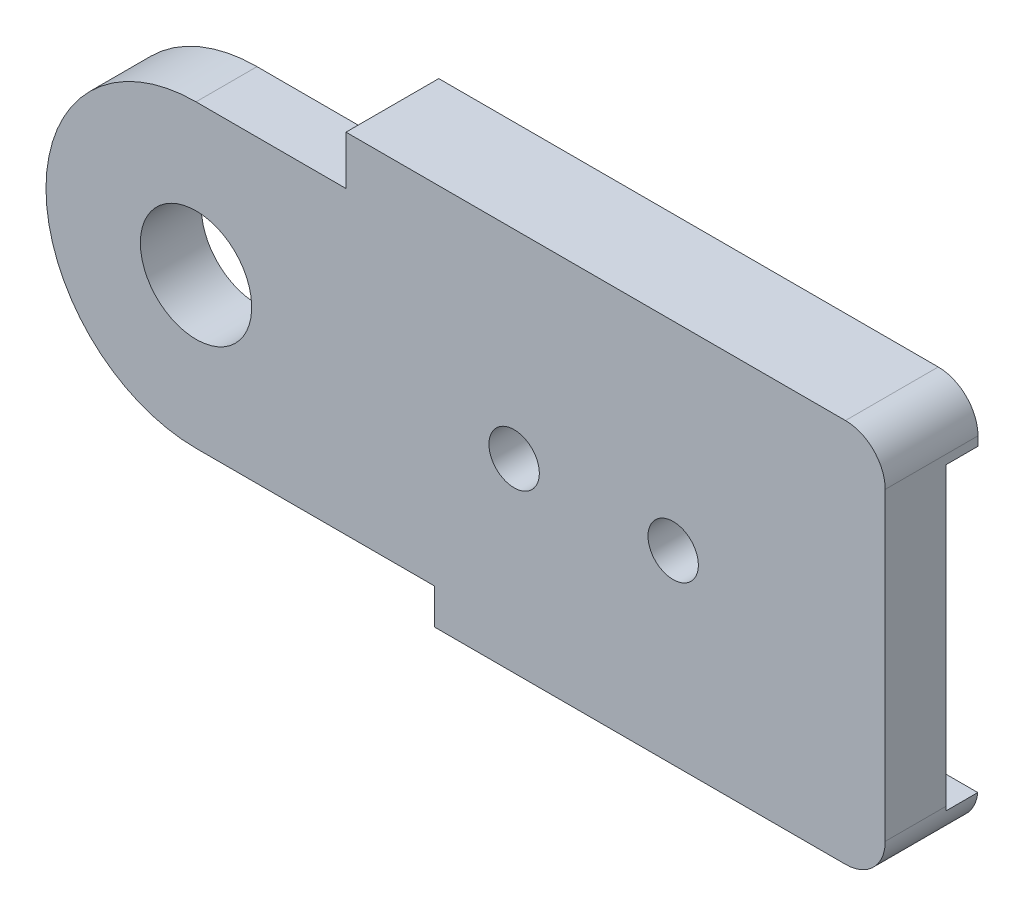
from build123d import *

# Parameters (mm, degrees)
BOSS_EXTRUDE1_DEPTH = 2
BOSS_EXTRUDE2_START = 2.5
BOSS_EXTRUDE2_DEPTH = 2.5
CUT_EXTRUDE1_DEPTH  = 2.5
BOSS_EXTRUDE3_DEPTH = 2.3
SKETCH9_R           = 2.1
CUT_EXTRUDE2_DEPTH  = 2.5
SKETCH10_R          = 2.5
BOSS_EXTRUDE4_DEPTH = 1.2
SKETCH11_R          = 0.95
CUT_EXTRUDE3_DEPTH  = 9.2
SKETCH12_R          = 2
CUT_EXTRUDE4_DEPTH  = 2.5
SKETCH14_W          = 20.343145751
SKETCH14_H          = 1.841510486
SKETCH14_W_2        = 17
SKETCH14_H_2        = 1.34163614
BOSS_EXTRUDE5_DEPTH = 1.2
FILLET1_R           = 1.5
SKETCH17_R          = 0.95
CUT_EXTRUDE5_DEPTH  = 3


# Read off the part's stored shape, not the designer's step: Boss-Extrude3
with BuildPart() as part:
    # Sketch5 → Boss-Extrude1 (new body)
    with BuildSketch(Plane.XY):
        with BuildLine():
            Line((8, 0), (9, -2.501635265))
            Line((9, -2.501635265), (9, -7.001635265))
            Line((9, -7.001635265), (26, -7.001635265))
            Line((26, -7.001635265), (26, 7.498364735))
            Line((26, 7.498364735), (5.656854249, 7.498364735))
            Line((5.656854249, 7.498364735), (5.656854249, 5.656854249))
            ThreePointArc((5.656854249, 5.656854249), (7.39103626, 3.061467459), (8, 0))
        make_face()
    extrude(amount=BOSS_EXTRUDE1_DEPTH)

    # Sketch6 → Boss-Extrude2 (add)
    with BuildSketch(Plane(origin=(0, 0, 0), x_dir=(-1, 0, 0), z_dir=(0, 0, -1)).offset(BOSS_EXTRUDE2_START)):
        with BuildLine():
            Line((-5.656854249, 7.498364735), (-5.656854249, 5.656854249))
            ThreePointArc((-5.656854249, 5.656854249), (-7.39103626, 3.061467459), (-8, 0))
            Line((-8, 0), (-9, -2.501635265))
            Line((-9, -2.501635265), (-9, -7.001635265))
            Line((-9, -7.001635265), (-26, -7.001635265))
            Line((-26, -7.001635265), (-26, 7.498364735))
            Line((-26, 7.498364735), (-5.656854249, 7.498364735))
        make_face()
    extrude(amount=-BOSS_EXTRUDE2_DEPTH)

    # Sketch7 → Cut-Extrude1 (cut)
    with BuildSketch(Plane(origin=(0, 0, -2.5), x_dir=(-1, 0, 0), z_dir=(0, 0, -1))):
        Polygon((-26, 5.298364735), (-2.738141148, 5.298364735), (-2.738141148, 3.998364735), (-29.849535112, 3.998364735), (-29.849535112, 5.298364735), align=None)
    extrude(amount=-CUT_EXTRUDE1_DEPTH, mode=Mode.SUBTRACT)

    # Boss-Extrude3 outline → Boss-Extrude3 (add)
    with BuildSketch(Plane(origin=(0, 0, -2.5), x_dir=(-1, 0, 0), z_dir=(0, 0, -1))):
        with BuildLine():
            Line((-9, -7.001635265), (-9, -5.659999125))
            Line((-9, -5.659999125), (0, -5.659998688))
            ThreePointArc((0, -5.659998688), (5.659998688, 0), (0, 5.659998688))
            Line((0, 5.659998688), (-5.656854249, 5.656854249))
            Line((-5.656854249, 5.656854249), (-5.656854249, 7.498364735))
            Line((-5.656854249, 7.498364735), (-26, 7.498364735))
            Line((-26, 7.498364735), (-26, -7.001635265))
            Line((-26, -7.001635265), (-9, -7.001635265))
        make_face()
    extrude(amount=BOSS_EXTRUDE3_DEPTH)

    # Sketch9 → Cut-Extrude2 (cut)
    with BuildSketch(Plane(origin=(0, 0, -4.8), x_dir=(-1, 0, 0), z_dir=(0, 0, -1))):
        Circle(SKETCH9_R)
    extrude(amount=-CUT_EXTRUDE2_DEPTH, mode=Mode.SUBTRACT)

    # Sketch10 → Boss-Extrude4 (add)
    with BuildSketch(Plane(origin=(0, 0, -4.8), x_dir=(-1, 0, 0), z_dir=(0, 0, -1))):
        with Locations((-12, 0)):
            Circle(SKETCH10_R)
        with Locations((-18, 0)):
            Circle(SKETCH10_R)
    extrude(amount=BOSS_EXTRUDE4_DEPTH)

    # Sketch11 → Cut-Extrude3 (cut)
    with BuildSketch(Plane(origin=(0, 0, -6), x_dir=(-1, 0, 0), z_dir=(0, 0, -1))):
        with Locations((-18, 0)):
            Circle(SKETCH11_R)
        with Locations((-12, 0)):
            Circle(SKETCH11_R)
    extrude(amount=-CUT_EXTRUDE3_DEPTH, mode=Mode.SUBTRACT)

    # Sketch12 → Cut-Extrude4 (cut)
    with BuildSketch(Plane.XY.offset(2)):
        with Locations((12, 0)):
            Circle(SKETCH12_R)
        with Locations((18, 0)):
            Circle(SKETCH12_R)
    extrude(amount=-CUT_EXTRUDE4_DEPTH, mode=Mode.SUBTRACT)

    # Sketch14 → Boss-Extrude5 (add)
    with BuildSketch(Plane(origin=(0, 0, -4.8), x_dir=(-1, 0, 0), z_dir=(0, 0, -1))):
        with Locations((-15.828427124, 6.577609492)):
            Rectangle(SKETCH14_W, SKETCH14_H)
        with Locations((-17.5, -6.330817195)):
            Rectangle(SKETCH14_W_2, SKETCH14_H_2)
    extrude(amount=BOSS_EXTRUDE5_DEPTH)

    # Fillet1
    # the kernel refuses this fillet: 1.5 mm, written as the material it takes off along each edge
    with BuildSketch(Plane(origin=(24.5, -5.501635265, 0.5), x_dir=(0, 0, 1), z_dir=(0, -1, 0))) as fillet1_piece_1_section:
        Polygon((0, 0), (FILLET1_R, 0), (FILLET1_R, -FILLET1_R), (0, -FILLET1_R), align=None)
    fillet1_piece_1 = extrude(amount=FILLET1_R, mode=Mode.PRIVATE)
    fillet1_piece_1 = fillet1_piece_1 - Plane(origin=(24.5, -5.501635265, 0.5), x_dir=(-0.7071067811865475, 0, -0.7071067811865475), z_dir=(0, -1, 0)) * Sphere(FILLET1_R, mode=Mode.PRIVATE)
    add(fillet1_piece_1, mode=Mode.SUBTRACT)
    with BuildSketch(Plane(origin=(24.5, 5.998364735, 0.5), x_dir=(0, 0, 1), z_dir=(0, 1, 0))) as fillet1_piece_2_section:
        Polygon((0, 0), (FILLET1_R, 0), (FILLET1_R, FILLET1_R), (0, FILLET1_R), align=None)
    fillet1_piece_2 = extrude(amount=FILLET1_R, mode=Mode.PRIVATE)
    fillet1_piece_2 = fillet1_piece_2 - Plane(origin=(24.5, 5.998364735, 0.5), x_dir=(-0.7071067811865475, 0, -0.7071067811865475), z_dir=(0, 1, 0)) * Sphere(FILLET1_R, mode=Mode.PRIVATE)
    add(fillet1_piece_2, mode=Mode.SUBTRACT)
    with BuildSketch(Plane(origin=(26, -5.501635265, 2), x_dir=(-1, 0, 0), z_dir=(0, 1, 0))) as fillet1_piece_3:
        with BuildLine():
            CenterArc((FILLET1_R, -FILLET1_R), FILLET1_R, 90, 90)
            Line((0, -FILLET1_R), (0, 0))
            Line((0, 0), (FILLET1_R, 0))
        make_face()
    extrude(amount=11.5, mode=Mode.SUBTRACT)
    with BuildSketch(Plane(origin=(26, -7.001635265, -2.5), x_dir=(-1, 0, 0), z_dir=(0, 0, 1))) as fillet1_piece_4:
        with BuildLine():
            CenterArc((FILLET1_R, -FILLET1_R), FILLET1_R, 90, 90)
            Line((0, -FILLET1_R), (0, 0))
            Line((0, 0), (FILLET1_R, 0))
        make_face()
    extrude(amount=3, mode=Mode.SUBTRACT)
    with BuildSketch(Plane(origin=(5.25, -7.001635265, 2), x_dir=(0, 1, 0), z_dir=(1, 0, 0))) as fillet1_piece_5:
        with BuildLine():
            CenterArc((FILLET1_R, -FILLET1_R), FILLET1_R, 90, 90)
            Line((0, -FILLET1_R), (0, 0))
            Line((0, 0), (FILLET1_R, 0))
        make_face()
    extrude(amount=19.25, mode=Mode.SUBTRACT)
    with BuildSketch(Plane(origin=(24.5, 7.498364735, 2), x_dir=(0, -1, 0), z_dir=(-1, 0, 0))) as fillet1_piece_6:
        with BuildLine():
            CenterArc((FILLET1_R, -FILLET1_R), FILLET1_R, 90, 90)
            Line((0, -FILLET1_R), (0, 0))
            Line((0, 0), (FILLET1_R, 0))
        make_face()
    extrude(amount=22.593145751, mode=Mode.SUBTRACT)
    with BuildSketch(Plane(origin=(26, 7.498364735, -2.5), x_dir=(-1, 0, 0), z_dir=(0, 0, 1))) as fillet1_piece_7:
        with BuildLine():
            CenterArc((FILLET1_R, FILLET1_R), FILLET1_R, 180, 90)
            Line((0, FILLET1_R), (0, 0))
            Line((0, 0), (FILLET1_R, 0))
        make_face()
    extrude(amount=3, mode=Mode.SUBTRACT)
    with BuildSketch(Plane(origin=(26, 7.498364735, -2.5), x_dir=(-1.0, -1.9174232572065026e-10, 0), z_dir=(0, 0, -1))) as fillet1_piece_8:
        with BuildLine():
            CenterArc((FILLET1_R, -FILLET1_R), FILLET1_R, 90.000000011, 90)
            Line((FILLET1_R * 1.9173522033e-10, -FILLET1_R), (0, 0))
            Line((0, 0), (FILLET1_R, 0))
        make_face()
    extrude(amount=2.3, mode=Mode.SUBTRACT)
    with BuildSketch(Plane(origin=(26, 7.498364735, -4.8), x_dir=(-1, 0, 0), z_dir=(0, 0, -1))) as fillet1_piece_9:
        with BuildLine():
            CenterArc((FILLET1_R, -FILLET1_R), FILLET1_R, 90, 90)
            Line((0, -FILLET1_R), (0, 0))
            Line((0, 0), (FILLET1_R, 0))
        make_face()
    extrude(amount=4.95, mode=Mode.SUBTRACT)
    with BuildSketch(Plane(origin=(26, -7.001635265, -2.5), x_dir=(-1.0, -1.9169850891861218e-10, 0), z_dir=(0, 0, -1))) as fillet1_piece_10:
        with BuildLine():
            CenterArc((FILLET1_R, FILLET1_R), FILLET1_R, 180.000000011, 90)
            Line((-FILLET1_R * 1.91707982785e-10, FILLET1_R), (0, 0))
            Line((0, 0), (FILLET1_R, 0))
        make_face()
    extrude(amount=2.3, mode=Mode.SUBTRACT)
    with BuildSketch(Plane(origin=(26, -7.001635265, -4.8), x_dir=(-1, 0, 0), z_dir=(0, 0, -1))) as fillet1_piece_11:
        with BuildLine():
            CenterArc((FILLET1_R, FILLET1_R), FILLET1_R, 180, 90)
            Line((0, FILLET1_R), (0, 0))
            Line((0, 0), (FILLET1_R, 0))
        make_face()
    extrude(amount=4.95, mode=Mode.SUBTRACT)

    # Sketch17 → Cut-Extrude5 (cut)
    with BuildSketch(Plane.XZ.offset(7.001635265)):
        with Locations((22, -1)):
            Circle(SKETCH17_R)
        with Locations((18, -1)):
            Circle(SKETCH17_R)
    extrude(amount=-CUT_EXTRUDE5_DEPTH, mode=Mode.SUBTRACT)


with BuildPart() as body_2:
    # Split1: the piece on the far side of the plane
    add(part.part)
    split(bisect_by=Plane(origin=(0, 0, -2.5), x_dir=(-1, 0, 0), z_dir=(0, 0, -1)), keep=Keep.BOTTOM)


with BuildPart() as part_1:
    add(part.part)

    # Split1
    split(bisect_by=Plane(origin=(0, 0, -2.5), x_dir=(-1, 0, 0), z_dir=(0, 0, -1)), keep=Keep.TOP)


solid = part_1.part
